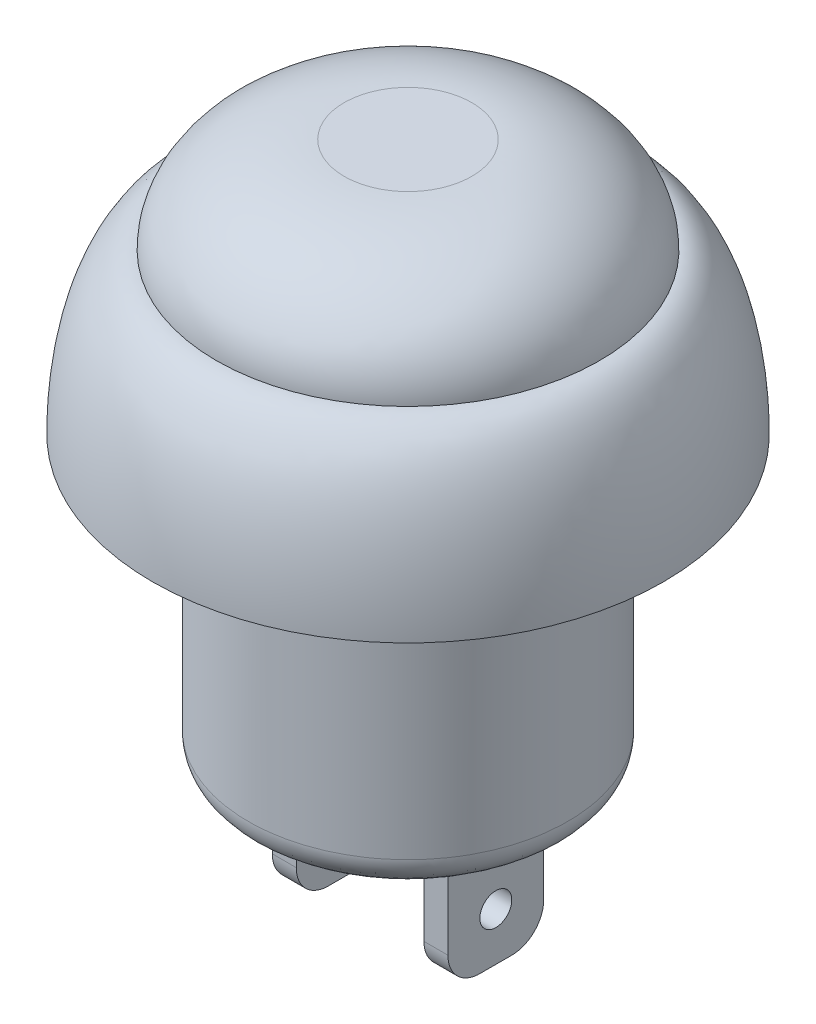
from build123d import *

# Parameters (mm, degrees)
SKETCH1_R             = 8
BOSS_EXTRUDE1_DEPTH   = 5
FILLET2_SIZE          = 5
FILLET2_SIZE_2        = 2
SKETCH2_R             = 6
BOSS_EXTRUDE2_DEPTH   = 3
FILLET3_SIZE          = 3
FILLET3_SIZE_2        = 4
SKETCH3_R             = 6
BOSS_EXTRUDE3_DEPTH   = 1
SKETCH4_R             = 5
BOSS_EXTRUDE4_DEPTH   = 8
FILLET4_R             = 1
SKETCH5_W             = 0.75
SKETCH5_H             = 3
BOSS_EXTRUDE5_DEPTH   = 4
BOSS_EXTRUDE5_2_DEPTH = 4
FILLET5_START         = -4
FILLET5_DEPTH         = 3
FILLET6_START         = 1
FILLET6_DEPTH         = 3
CUT_EXTRUDE1_START    = -10.75
SKETCH6_R             = 0.5
CUT_EXTRUDE1_DEPTH    = 16


with BuildPart() as part:
    # Sketch1 → Boss-Extrude1 (new body)
    with BuildSketch(Plane(origin=(0, 0, 0), x_dir=(1, 0, 0), z_dir=(0, 1, 0))):
        with Locations(Location((0, 0, 0), (0, 0, 270))):
            Circle(SKETCH1_R)
    extrude(amount=BOSS_EXTRUDE1_DEPTH)

    # Fillet2
    # a fillet whose section is not a circle: 5, 2 mm, written as the material it takes off along each edge
    with BuildSketch(Plane(origin=(0, 5, 0), x_dir=(0, 0, 1), z_dir=(-1, 0, 0))) as fillet2_piece_1:
        with BuildLine():
            Bezier((8, -FILLET2_SIZE), (8, 0), (8 - FILLET2_SIZE_2, 0), weights=[1, 0.707106781, 1])
            Line((8 - FILLET2_SIZE_2, 0), (8, 0))
            Line((8, 0), (8, -FILLET2_SIZE))
        make_face()
    revolve(axis=Axis((0, 5, 0), (0, 1, 0)), mode=Mode.SUBTRACT)

    # Sketch2 → Boss-Extrude2 (add)
    with BuildSketch(Plane(origin=(0, 5, 0), x_dir=(1, 0, 0), z_dir=(0, 1, 0))):
        with Locations(Location((0, 0, 0), (0, 0, 270))):
            Circle(SKETCH2_R)
    extrude(amount=BOSS_EXTRUDE2_DEPTH)

    # Fillet3
    # a fillet whose section is not a circle: 4, 3 mm, written as the material it takes off along each edge
    with BuildSketch(Plane(origin=(0, 8, 0), x_dir=(0, 0, 1), z_dir=(-1, 0, 0))) as fillet3_piece_1:
        with BuildLine():
            Bezier((6, -FILLET3_SIZE), (6, 0), (6 - FILLET3_SIZE_2, 0), weights=[1, 0.707106781, 1])
            Line((6 - FILLET3_SIZE_2, 0), (6, 0))
            Line((6, 0), (6, -FILLET3_SIZE))
        make_face()
    revolve(axis=Axis((0, 8, 0), (0, 1, 0)), mode=Mode.SUBTRACT)


with BuildPart() as body_2:
    # Sketch3 → Boss-Extrude3 (new body)
    with BuildSketch(Plane.XZ):
        with Locations(Location((0, 0, 0), (0, 0, 270))):
            Circle(SKETCH3_R)
    extrude(amount=BOSS_EXTRUDE3_DEPTH)


with BuildPart() as body_3:
    # Sketch4 → Boss-Extrude4 (new body)
    with BuildSketch(Plane.XZ.offset(1)):
        with Locations(Location((0, 0, 0), (0, 0, 270))):
            Circle(SKETCH4_R)
    extrude(amount=BOSS_EXTRUDE4_DEPTH)

    # Fillet4
    fillet4_edges = [body_3.edges().sort_by_distance(p)[0] for p in [
        (0, -9, 5),
    ]]
    fillet(fillet4_edges, radius=FILLET4_R)


with BuildPart() as body_4:
    # Sketch5 → Boss-Extrude5 (new body)
    with BuildSketch(Plane.XZ.offset(9)):
        with Locations((-2.375, 0)):
            Rectangle(SKETCH5_W, SKETCH5_H)
    extrude(amount=BOSS_EXTRUDE5_DEPTH)

    # Fillet5: read off the stored shape, not the designer's step
    # Fillet5 outline → Fillet5 (cut)
    with BuildSketch(Plane.YZ.offset(FILLET5_START)):
        with BuildLine():
            add(Edge.make_bspline(
                [(-13, -0.5), (-13, -1.5), (-12, -1.5)],
                knots=[0, 0, 0, 1, 1, 1], degree=2, weights=[1, 0.707106781, 1]))
            Line((-13, -0.5), (-13, -1.5))
            Line((-13, -1.5), (-12, -1.5))
        make_face()
        with BuildLine():
            Line((-13, 1.5), (-13, 0.5))
            add(Edge.make_bspline(
                [(-13, 0.5), (-13, 1.5), (-12, 1.5)],
                knots=[0, 0, 0, 1, 1, 1], degree=2, weights=[1, 0.707106781, 1]))
            Line((-12, 1.5), (-13, 1.5))
        make_face()
    extrude(amount=FILLET5_DEPTH, mode=Mode.SUBTRACT)


with BuildPart() as body_5:
    # Sketch5 → Boss-Extrude5 2 (new body)
    with BuildSketch(Plane.XZ.offset(9)):
        with Locations((2.375, 0)):
            Rectangle(SKETCH5_W, SKETCH5_H)
    extrude(amount=BOSS_EXTRUDE5_2_DEPTH)

    # Fillet6: read off the stored shape, not the designer's step
    # Fillet6 outline → Fillet6 (cut)
    with BuildSketch(Plane.YZ.offset(FILLET6_START)):
        with BuildLine():
            add(Edge.make_bspline(
                [(-13, -0.5), (-13, -1.5), (-12, -1.5)],
                knots=[0, 0, 0, 1, 1, 1], degree=2, weights=[1, 0.707106781, 1]))
            Line((-13, -0.5), (-13, -1.5))
            Line((-13, -1.5), (-12, -1.5))
        make_face()
        with BuildLine():
            Line((-13, 1.5), (-13, 0.5))
            add(Edge.make_bspline(
                [(-13, 0.5), (-13, 1.5), (-12, 1.5)],
                knots=[0, 0, 0, 1, 1, 1], degree=2, weights=[1, 0.707106781, 1]))
            Line((-12, 1.5), (-13, 1.5))
        make_face()
    extrude(amount=FILLET6_DEPTH, mode=Mode.SUBTRACT)


with BuildPart() as cut_extrude1_tool:
    # Sketch6 → Cut-Extrude1 (new body)
    with BuildSketch(Plane.ZY.offset(2.75).offset(CUT_EXTRUDE1_START)):
        with Locations((0, -11.5)):
            Circle(SKETCH6_R)
    extrude(amount=CUT_EXTRUDE1_DEPTH)


with BuildPart() as body_4_1:
    add(body_4.part)

    # Cut-Extrude1: cut by cut_extrude1_tool
    add(cut_extrude1_tool.part, mode=Mode.SUBTRACT)


with BuildPart() as body_5_1:
    add(body_5.part)

    # Cut-Extrude1: cut by cut_extrude1_tool
    add(cut_extrude1_tool.part, mode=Mode.SUBTRACT)


solid = Compound([part.part, body_2.part, body_3.part, body_4_1.part, body_5_1.part])
